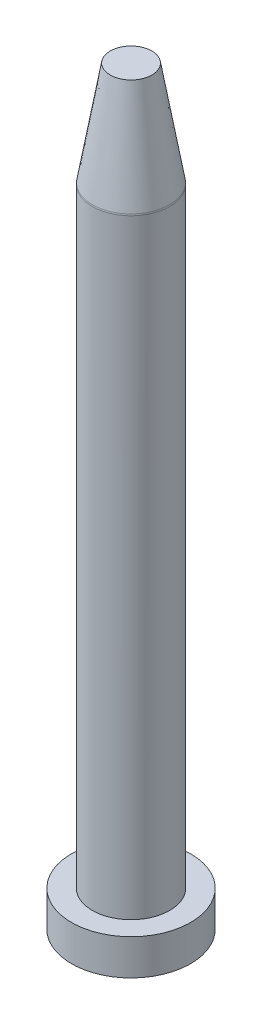
from build123d import *

# Parameters (mm, degrees)
FILLET_1_R = 3


with BuildPart() as part:
    # 草图1 → Revolve 297 (revolve)
    with BuildSketch(Plane.XY):
        Polygon((0, 0), (20, 0), (20, 12), (13, 12), (13, 217), (7, 252), (0, 252), align=None)
    revolve(axis=Axis((0, 0, 0), (0, 1, 0)))

    # 圆角1
    fillet_1_edges = [part.edges().sort_by_distance(p)[0] for p in [
        (-13, 217, 0),
    ]]
    fillet(fillet_1_edges, radius=FILLET_1_R)


solid = part.part
